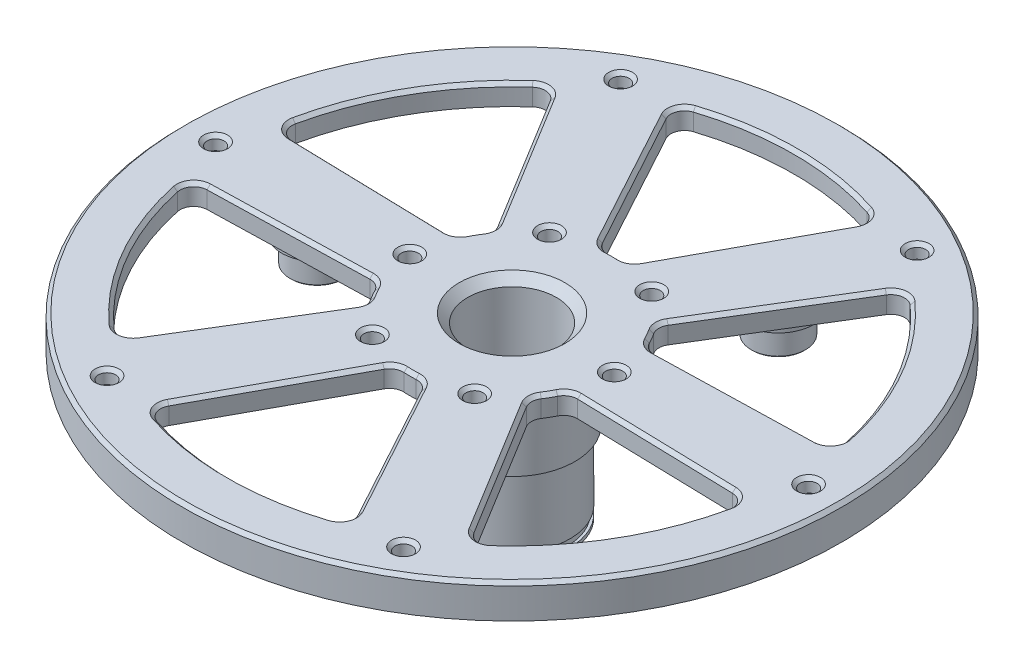
from build123d import *

# Parameters (mm, degrees)
SKETCH2_W                                     = 0.75
SKETCH2_H                                     = 12.25
CIRPATTERN2_COUNT                             = 3
CHAMFER1_SIZE                                 = 1.25
M3X0_5_TAPPED_HOLE_60_MM_DIAMETER_D           = 2.5
M3X0_5_TAPPED_HOLE_60_MM_DIAMETER_CSINK_D     = 3.5
M3X0_5_TAPPED_HOLE_60_MM_DIAMETER_CSINK_ANGLE = 90
CIRPATTERN3_COUNT                             = 6
CUT_EXTRUDE1_DEPTH                            = 72.270295355
CIRPATTERN4_COUNT                             = 6
CHAMFER2_SIZE                                 = 0.5
CHAMFER3_SIZE                                 = 0.5
SKETCH14_W                                    = 6.551993776
SKETCH14_H                                    = 1.1
CHAMFER4_SIZE                                 = 0.5
CHAMFER5_SIZE                                 = 0.2


with BuildPart() as part:
    # Sketch1 → Shaft (revolve)
    with BuildSketch(Plane.XY):
        Polygon((-6.5, 18.1), (-6.5, -1.95), (-4.5, -1.95), (-4.5, -3.95), (-6.6, -3.95), (-6.6, -6.45), (-8.48, -6.45), (-8.48, 18.1), align=None)
    revolve(axis=Axis((0, 0, 0), (0, -1, 0)))

    # Sketch2 → Revolve1 (revolve)
    with BuildSketch(Plane.XY):
        with Locations((-8.855, 11.975)):
            Rectangle(SKETCH2_W, SKETCH2_H)
    revolve(axis=Axis((0, 0, 0), (0, 1, 0)))



with BuildPart() as body_2:
    # Sketch4 → Revolve2 (revolve)
    with BuildSketch(Plane.XY):
        Polygon((-28.599, 12), (-28.599, 18.1), (-33.789, 18.1), (-33.789, 16), (-32.589, 16), (-32.589, 12), align=None)
    revolve(axis=Axis((-28.599, 12.136274552, 0), (0, -1, 0)))


with BuildPart() as cirpattern2_1:
    # CirPattern2: pattern copy
    add(body_2.part.rotate(Axis((0, 0, 0), (0, 1, 0)), 1 * 360 / CIRPATTERN2_COUNT))


with BuildPart() as cirpattern2_2:
    # CirPattern2: pattern copy
    add(body_2.part.rotate(Axis((0, 0, 0), (0, 1, 0)), 2 * 360 / CIRPATTERN2_COUNT))


with BuildPart() as part_1:
    add(part.part)

    add(body_2.part)  # Revolve3 merges body 2

    add(cirpattern2_1.part)  # Revolve3 merges CirPattern2_1

    add(cirpattern2_2.part)  # Revolve3 merges CirPattern2_2
    # Sketch8 → Revolve3 (revolve)
    with BuildSketch(Plane.XY):
        Polygon((-48.35, 20.1), (-6.5, 20.1), (-6.5, 17.1), (-42.519999369, 17.1), (-42.519999369, 18.1), (-47.35, 18.1), (-47.35, 15.15), (-48.35, 15.15), align=None)
    revolve(axis=Axis((0, 0, 0), (0, 1, 0)))

    # Chamfer1
    chamfer1_edges = [part_1.edges().sort_by_distance(p)[0] for p in [
        (6.5, 20.1, 0),
    ]]
    chamfer(chamfer1_edges, length=CHAMFER1_SIZE)

    # M3x0.5 Tapped Hole - 60 mm diameter (through all)
    with Locations(Plane(origin=(0, 20.1, 0), x_dir=(1, 0, 0), z_dir=(0, 1, 0))):
        with Locations((-15, 0), (-43.5, 0)):
            m3x0_5_tapped_hole_60_mm_diameter = CounterSinkHole(M3X0_5_TAPPED_HOLE_60_MM_DIAMETER_D / 2, M3X0_5_TAPPED_HOLE_60_MM_DIAMETER_CSINK_D / 2, counter_sink_angle=M3X0_5_TAPPED_HOLE_60_MM_DIAMETER_CSINK_ANGLE)

    # CirPattern3: M3x0.5 Tapped Hole - 60 mm diameter ×6 about axis
    cirpattern3_axis = Axis((0, 0, 0), (0, 1, 0))
    for i in range(1, CIRPATTERN3_COUNT):
        add(m3x0_5_tapped_hole_60_mm_diameter.rotate(cirpattern3_axis, i * 360 / CIRPATTERN3_COUNT), mode=Mode.SUBTRACT)

    # Sketch13 → Cut-Extrude1 (cut, through all)
    with BuildSketch(Plane(origin=(0, 0, 0), x_dir=(1, 0, 0), z_dir=(0, 1, 0))):
        with BuildLine():
            Line((-13.883389556, -36.479634299), (-2.757092363, -16.015247917))
            ThreePointArc((-2.757092363, -16.015247917), (-1.971072098, -15.222129456), (-0.882352941, -14.974025955))
            ThreePointArc((-0.882352941, -14.974025955), (0, -15), (0.882352941, -14.974025955))
            ThreePointArc((0.882352941, -14.974025955), (1.971072098, -15.222129456), (2.757092363, -16.015247917))
            Line((2.757092363, -16.015247917), (13.883389556, -36.479634299))
            ThreePointArc((13.883389556, -36.479634299), (13.983794699, -38.176368726), (12.742627419, -39.337614906))
            ThreePointArc((12.742627419, -39.337614906), (0, -41.35), (-12.742627419, -39.337614906))
            ThreePointArc((-12.742627419, -39.337614906), (-13.983794699, -38.176368726), (-13.883389556, -36.479634299))
        make_face()
    cut_extrude1 = extrude(amount=CUT_EXTRUDE1_DEPTH, mode=Mode.SUBTRACT)

    # CirPattern4: Cut-Extrude1 ×6 about axis
    cirpattern4_axis = Axis((0, 0, 0), (0, 1, 0))
    for i in range(1, CIRPATTERN4_COUNT):
        add(cut_extrude1.rotate(cirpattern4_axis, i * 360 / CIRPATTERN4_COUNT), mode=Mode.SUBTRACT)

    # Chamfer2
    chamfer2_edges = [part_1.edges().sort_by_distance(p)[0] for p in [
        (-26.891071264, 20.1, 5.918180517),
        (-40.05360249, 20.1, 6.977862912),
        (-14.168286857, 20.1, 5.904066218),
        (-12.990381057, 20.1, 7.5),
        (-26.069807791, 20.1, 31.198505813),
        (-12.197214759, 20.1, 9.318063238),
        (-18.570830304, 20.1, 20.329260591),
        (-8.32024096, 20.1, 26.247441108),
        (-13.983794699, 20.1, 38.176368726),
        (-1.971072098, 20.1, 15.222129456),
        (0, 20.1, 15),
        (13.983794699, 20.1, 38.176368726),
        (1.971072098, 20.1, 15.222129456),
        (8.32024096, 20.1, 26.247441108),
        (18.570830304, 20.1, 20.329260591),
        (26.069807791, 20.1, 31.198505813),
        (12.197214759, 20.1, 9.318063238),
        (12.990381057, 20.1, 7.5),
        (40.05360249, 20.1, 6.977862912),
        (14.168286857, 20.1, 5.904066218),
        (26.891071264, 20.1, 5.918180517),
        (26.891071264, 20.1, -5.918180517),
        (40.05360249, 20.1, -6.977862912),
        (14.168286857, 20.1, -5.904066218),
        (12.990381057, 20.1, -7.5),
        (26.069807791, 20.1, -31.198505813),
        (12.197214759, 20.1, -9.318063238),
        (18.570830304, 20.1, -20.329260591),
        (8.32024096, 20.1, -26.247441108),
        (13.983794699, 20.1, -38.176368726),
        (1.971072098, 20.1, -15.222129456),
        (0, 20.1, -15),
        (-13.983794699, 20.1, -38.176368726),
        (-1.971072098, 20.1, -15.222129456),
        (-8.32024096, 20.1, -26.247441108),
        (-26.891071264, 20.1, -5.918180517),
        (-14.168286857, 20.1, -5.904066218),
        (-40.05360249, 20.1, -6.977862912),
        (-12.990381057, 20.1, -7.5),
        (-12.197214759, 20.1, -9.318063238),
        (-26.069807791, 20.1, -31.198505813),
        (-18.570830304, 20.1, -20.329260591),
        (-35.810150446, 20.1, 20.675),
        (0, 20.1, 41.35),
        (35.810150446, 20.1, 20.675),
        (35.810150446, 20.1, -20.675),
        (0, 20.1, -41.35),
        (-35.810150446, 20.1, -20.675),
    ]]
    chamfer(chamfer2_edges, length=CHAMFER2_SIZE)

    # Chamfer3
    chamfer3_edges = [part_1.edges().sort_by_distance(p)[0] for p in [
        (48.35, 20.1, 0),
    ]]
    chamfer(chamfer3_edges, length=CHAMFER3_SIZE)

    # Sketch14 → Cut-Revolve1 (revolve, cut)
    with BuildSketch(Plane.XY):
        with Locations((-11.375996888, -4.9)):
            Rectangle(SKETCH14_W, SKETCH14_H)
    revolve(axis=Axis((0, 0, 0), (0, -1, 0)), mode=Mode.SUBTRACT)

    # Chamfer4
    chamfer4_edges = [part_1.edges().sort_by_distance(p)[0] for p in [
        (8.48, -6.45, 0),
    ]]
    chamfer(chamfer4_edges, length=CHAMFER4_SIZE)

    # Chamfer5
    chamfer5_edges = [part_1.edges().sort_by_distance(p)[0] for p in [
        (12.3045, 12, -21.312019162),
        (12.3045, 12, 21.312019162),
        (-24.609, 12, 0),
    ]]
    chamfer(chamfer5_edges, length=CHAMFER5_SIZE)


solid = part_1.part
